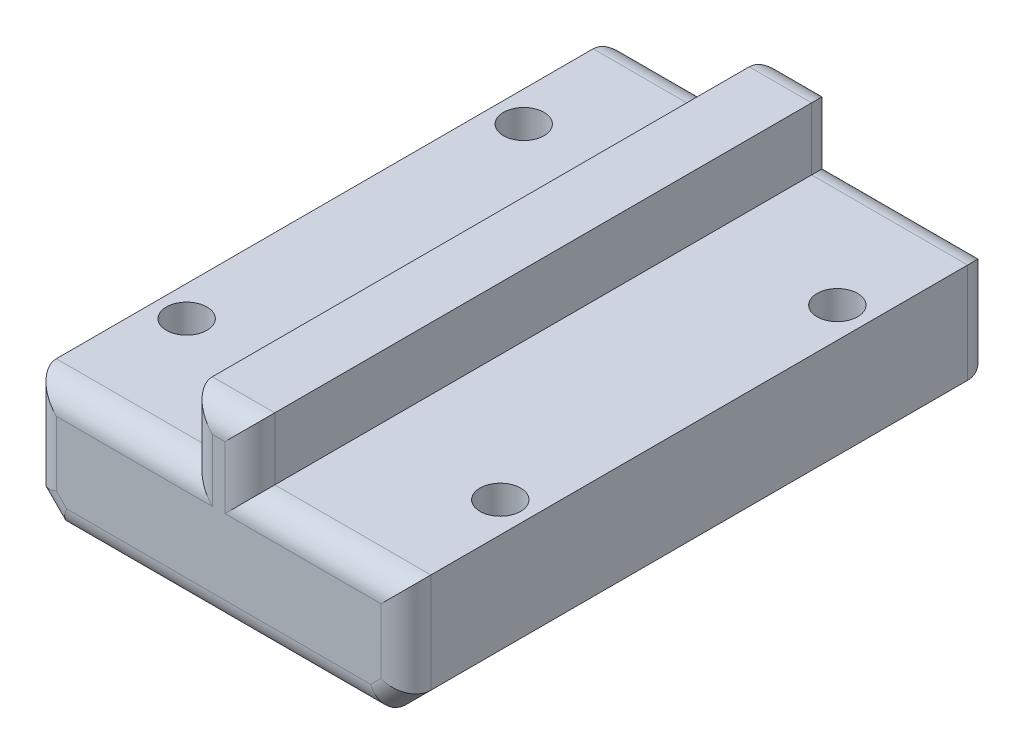
from build123d import *

# Parameters (mm, degrees)
SKETCH1_W                    = 30
SKETCH1_H                    = 47
BOSS_EXTRUDE1_DEPTH          = 10
SKETCH2_W                    = 5
SKETCH2_H                    = 47
BOSS_EXTRUDE2_DEPTH          = 5
SKETCH3_R                    = 1.625
CUT_EXTRUDE1_DEPTH           = 32.658332237
SKETCH4_R                    = 2.7
CUT_EXTRUDE2_DEPTH           = 1.45
CHAMFER1_SIZE                = 2
CHAMFER2_SIZE                = 2
FILLET1_R                    = 2
FILLET2_R                    = 2
CUT_EXTRUDE6_DEPTH           = 1.5
CUT_EXTRUDE6_DRAFT           = 4
CUT_EXTRUDE6_PROFILE_2_DEPTH = 1.5
CUT_EXTRUDE6_PROFILE_2_DRAFT = 4
CUT_EXTRUDE6_PROFILE_3_DEPTH = 1.5
CUT_EXTRUDE6_PROFILE_3_DRAFT = 4
CUT_EXTRUDE6_PROFILE_4_DEPTH = 1.5
CUT_EXTRUDE6_PROFILE_4_DRAFT = 4
CUT_EXTRUDE6_PROFILE_5_DEPTH = 1.5
CUT_EXTRUDE6_PROFILE_5_DRAFT = 4


with BuildPart() as part:
    # Sketch1 → Boss-Extrude1 (new body)
    with BuildSketch(Plane(origin=(0, 0, 0), x_dir=(1, 0, 0), z_dir=(0, 1, 0))):
        Rectangle(SKETCH1_W, SKETCH1_H)
    extrude(amount=BOSS_EXTRUDE1_DEPTH)

    # Sketch2 → Boss-Extrude2 (add)
    with BuildSketch(Plane(origin=(0, 10, 0), x_dir=(1, 0, 0), z_dir=(0, 1, 0))):
        Rectangle(SKETCH2_W, SKETCH2_H)
    extrude(amount=BOSS_EXTRUDE2_DEPTH)

    # Sketch3 → Cut-Extrude1 (cut, through all)
    with BuildSketch(Plane.XZ):
        with Locations(Location((-12.56, 13.5, 0), (0, 0, 270))):
            Circle(SKETCH3_R)
        with Locations(Location((-12.56, -13.5, 0), (0, 0, 270))):
            Circle(SKETCH3_R)
        with Locations(Location((12.56, -13.5, 0), (0, 0, 270))):
            Circle(SKETCH3_R)
        with Locations(Location((12.56, 13.5, 0), (0, 0, 270))):
            Circle(SKETCH3_R)
    extrude(amount=-CUT_EXTRUDE1_DEPTH, mode=Mode.SUBTRACT)

    # Sketch4 → Cut-Extrude2 (cut)
    with BuildSketch(Plane.XZ):
        with Locations((-12.56, 13.5)):
            Circle(SKETCH4_R)
        with Locations((-12.56, -13.5)):
            Circle(SKETCH4_R)
        with Locations((12.56, -13.5)):
            Circle(SKETCH4_R)
        with Locations((12.56, 13.5)):
            Circle(SKETCH4_R)
    extrude(amount=-CUT_EXTRUDE2_DEPTH, mode=Mode.SUBTRACT)

    # Chamfer1
    # the kernel refuses this chamfer: 2 mm, written as the material it takes off along each edge
    with BuildSketch(Plane(origin=(-15, 0, -28.643365976), x_dir=(0.9996219169112968, -0.027495876610586365, 0), z_dir=(0, 0, 1)), Plane(origin=(-15, 0, 9.512661705), x_dir=(0.9996219169112968, -0.027495876610586365, 0), z_dir=(0, 0, 1))) as chamfer1_piece_1:
        Polygon((CHAMFER1_SIZE * 0.999621916911, CHAMFER1_SIZE * 0.0274958766106), (-CHAMFER1_SIZE * 0.0274958766106, CHAMFER1_SIZE * 0.999621916911), (0, 0), align=None)
    extrude(amount=19.130704271, mode=Mode.SUBTRACT)
    with BuildSketch(Plane(origin=(-15, 0, -17.487338295), x_dir=(0.9996219169112968, -0.027495876610586365, 0), z_dir=(0, 0, 1))) as chamfer1_piece_2:
        Polygon((CHAMFER1_SIZE * 0.999621916911, CHAMFER1_SIZE * 0.0274958766106), (-CHAMFER1_SIZE * 0.0274958766106, CHAMFER1_SIZE * 0.999621916911), (0, 0), align=None)
    extrude(amount=34.974676589, mode=Mode.SUBTRACT)

    # Chamfer2
    # the kernel refuses this chamfer: 2 mm, written as the material it takes off along each edge
    with BuildSketch(Plane(origin=(15, 0, 28.643365976), x_dir=(0.027495876610586494, 0.9996219169112968, 0), z_dir=(0, 0, -1)), Plane(origin=(15, 0, -9.512661705), x_dir=(0.027495876610586494, 0.9996219169112968, 0), z_dir=(0, 0, -1))) as chamfer2_piece_1:
        Polygon((CHAMFER2_SIZE * 0.999621916911, -CHAMFER2_SIZE * 0.0274958766106), (-CHAMFER2_SIZE * 0.0274958766106, -CHAMFER2_SIZE * 0.999621916911), (0, 0), align=None)
    extrude(amount=19.130704271, mode=Mode.SUBTRACT)
    with BuildSketch(Plane(origin=(15, 0, 17.487338295), x_dir=(0.027495876610586494, 0.9996219169112968, 0), z_dir=(0, 0, -1))) as chamfer2_piece_2:
        Polygon((CHAMFER2_SIZE * 0.999621916911, -CHAMFER2_SIZE * 0.0274958766106), (-CHAMFER2_SIZE * 0.0274958766106, -CHAMFER2_SIZE * 0.999621916911), (0, 0), align=None)
    extrude(amount=34.974676589, mode=Mode.SUBTRACT)

    # Fillet1
    fillet1_edges = [part.edges().sort_by_distance(p)[0] for p in [
        (-14, 1, 23.5),
        (-15, 6, 23.5),
        (-8.75, 10, 23.5),
        (-2.5, 12.5, 23.5),
        (0, 15, 23.5),
        (2.5, 12.5, 23.5),
        (8.75, 10, 23.5),
        (15, 6, 23.5),
        (14, 1, 23.5),
        (0, 0, 23.5),
    ]]
    fillet(fillet1_edges, radius=FILLET1_R)

    # Fillet2
    fillet2_edges = [part.edges().sort_by_distance(p)[0] for p in [
        (8.75, 10, -23.5),
        (2.5, 12.5, -23.5),
        (0, 15, -23.5),
        (-2.5, 12.5, -23.5),
        (-8.75, 10, -23.5),
        (-15, 6, -23.5),
        (-14, 1, -23.5),
        (0, 0, -23.5),
        (14, 1, -23.5),
        (15, 6, -23.5),
    ]]
    fillet(fillet2_edges, radius=FILLET2_R)


with BuildPart() as cut_extrude6_tool:
    # Mobious Logo → Cut-Extrude6 (with draft: the straight prism first)
    with BuildSketch(Plane.XZ):
        Polygon((-8.928580544, -5.393458037), (-8.928580544, -6.93818631), (0.653971114, -12.514917192), (0.653971114, -3.429820402), (-0.949401841, -4.248746813), (-0.949401841, -10.158552031), align=None)
    extrude(amount=-CUT_EXTRUDE6_DEPTH)
    # Cut-Extrude6: the draft: its side faces are tilted about the plane it starts from
    cut_extrude6_sides = [cut_extrude6_tool.faces().sort_by_distance(p)[0] for p in [
        (-8.928580544, 0.75, -6.165822173),
        (-4.137304715, 0.75, -9.726551751),
        (0.653971114, 0.75, -7.972368797),
        (-0.147715364, 0.75, -3.839283608),
        (-0.949401841, 0.75, -7.203649422),
        (-4.938991193, 0.75, -7.776005034),
    ]]
    draft(cut_extrude6_sides, Plane.XZ, CUT_EXTRUDE6_DRAFT)


with BuildPart() as part_1:
    add(part.part)

    # Cut-Extrude6: cut by cut_extrude6_tool
    add(cut_extrude6_tool.part, mode=Mode.SUBTRACT)


with BuildPart() as cut_extrude6_profile_2_tool:
    # Mobious Logo → Cut-Extrude6 profile 2 (with draft: the straight prism first)
    with BuildSketch(Plane.XZ):
        Polygon((-4.084941045, -5.681458223), (1.099062311, -2.555426049), (1.099062311, -12.520785535), (2.643790584, -12.174553336), (2.643790584, -0.471273032), (-5.23694179, -4.974548675), align=None)
    extrude(amount=-CUT_EXTRUDE6_PROFILE_2_DEPTH)
    # Cut-Extrude6 profile 2: the draft: its side faces are tilted about the plane it starts from
    cut_extrude6_profile_2_sides = [cut_extrude6_profile_2_tool.faces().sort_by_distance(p)[0] for p in [
        (-1.492939367, 0.75, -4.118442136),
        (1.099062311, 0.75, -7.538105792),
        (1.871426448, 0.75, -12.347669435),
        (2.643790584, 0.75, -6.322913184),
        (-1.296575603, 0.75, -2.722910854),
        (-4.660941418, 0.75, -5.328003449),
    ]]
    draft(cut_extrude6_profile_2_sides, Plane.XZ, CUT_EXTRUDE6_PROFILE_2_DRAFT)


with BuildPart() as part_2:
    add(part_1.part)

    # Cut-Extrude6 profile 2: cut by cut_extrude6_profile_2_tool
    add(cut_extrude6_profile_2_tool.part, mode=Mode.SUBTRACT)


with BuildPart() as cut_extrude6_profile_3_tool:
    # Mobious Logo → Cut-Extrude6 profile 3 (with draft: the straight prism first)
    with BuildSketch(Plane.XZ):
        Polygon((-1.414393861, -9.346915142), (-1.414393861, -7.767367916), (-6.320622953, -4.974548675), (2.486400923, 0.065282344), (-6.091859658, 4.94836684), (-1.414393861, 7.625052806), (-1.414393861, 9.113526764), (-8.692944028, 4.94836684), (0, 0), (-8.692944028, -4.974548675), align=None)
    extrude(amount=-CUT_EXTRUDE6_PROFILE_3_DEPTH)
    # Cut-Extrude6 profile 3: the draft: its side faces are tilted about the plane it starts from
    cut_extrude6_profile_3_sides = [cut_extrude6_profile_3_tool.faces().sort_by_distance(p)[0] for p in [
        (-1.414393861, 0.75, -8.557141529),
        (-3.867508407, 0.75, -6.370958296),
        (-1.917111015, 0.75, -2.454633165),
        (-1.802729367, 0.75, 2.506824592),
        (-3.75312676, 0.75, 6.286709823),
        (-1.414393861, 0.75, 8.369289785),
        (-5.053668945, 0.75, 7.030946802),
        (-4.346472014, 0.75, 2.47418342),
        (-4.346472014, 0.75, -2.487274337),
        (-5.053668945, 0.75, -7.160731908),
    ]]
    draft(cut_extrude6_profile_3_sides, Plane.XZ, CUT_EXTRUDE6_PROFILE_3_DRAFT)


with BuildPart() as part_3:
    add(part_2.part)

    # Cut-Extrude6 profile 3: cut by cut_extrude6_profile_3_tool
    add(cut_extrude6_profile_3_tool.part, mode=Mode.SUBTRACT)


with BuildPart() as cut_extrude6_profile_4_tool:
    # Mobious Logo → Cut-Extrude6 profile 4 (with draft: the straight prism first)
    with BuildSketch(Plane.XZ):
        Polygon((-8.928580544, 5.393458037), (-0.949401841, 9.975279185), (-0.949401841, 4.293820961), (0.653971114, 3.272729391), (0.653971114, 12.384008017), (-8.928580544, 6.859640804), align=None)
    extrude(amount=-CUT_EXTRUDE6_PROFILE_4_DEPTH)
    # Cut-Extrude6 profile 4: the draft: its side faces are tilted about the plane it starts from
    cut_extrude6_profile_4_sides = [cut_extrude6_profile_4_tool.faces().sort_by_distance(p)[0] for p in [
        (-4.938991193, 0.75, 7.684368611),
        (-0.949401841, 0.75, 7.134550073),
        (-0.147715364, 0.75, 3.783275176),
        (0.653971114, 0.75, 7.828368704),
        (-4.137304715, 0.75, 9.62182441),
        (-8.928580544, 0.75, 6.126549421),
    ]]
    draft(cut_extrude6_profile_4_sides, Plane.XZ, CUT_EXTRUDE6_PROFILE_4_DRAFT)


with BuildPart() as part_4:
    add(part_3.part)

    # Cut-Extrude6 profile 4: cut by cut_extrude6_profile_4_tool
    add(cut_extrude6_profile_4_tool.part, mode=Mode.SUBTRACT)


with BuildPart() as cut_extrude6_profile_5_tool:
    # Mobious Logo → Cut-Extrude6 profile 5 (with draft: the straight prism first)
    with BuildSketch(Plane.XZ):
        Polygon((-5.23694179, 4.94836684), (2.643790584, 0.418909362), (2.643790584, 11.965098655), (1.099062311, 12.577663315), (1.099062311, 2.487274337), (-4.143752967, 5.500586773), align=None)
    extrude(amount=-CUT_EXTRUDE6_PROFILE_5_DEPTH)
    # Cut-Extrude6 profile 5: the draft: its side faces are tilted about the plane it starts from
    cut_extrude6_profile_5_sides = [cut_extrude6_profile_5_tool.faces().sort_by_distance(p)[0] for p in [
        (-1.296575603, 0.75, 2.683638101),
        (2.643790584, 0.75, 6.192004008),
        (1.871426448, 0.75, 12.271380985),
        (1.099062311, 0.75, 7.532468826),
        (-1.522345328, 0.75, 3.993930555),
        (-4.690347379, 0.75, 5.224476806),
    ]]
    draft(cut_extrude6_profile_5_sides, Plane.XZ, CUT_EXTRUDE6_PROFILE_5_DRAFT)


with BuildPart() as part_5:
    add(part_4.part)

    # Cut-Extrude6 profile 5: cut by cut_extrude6_profile_5_tool
    add(cut_extrude6_profile_5_tool.part, mode=Mode.SUBTRACT)


solid = part_5.part
